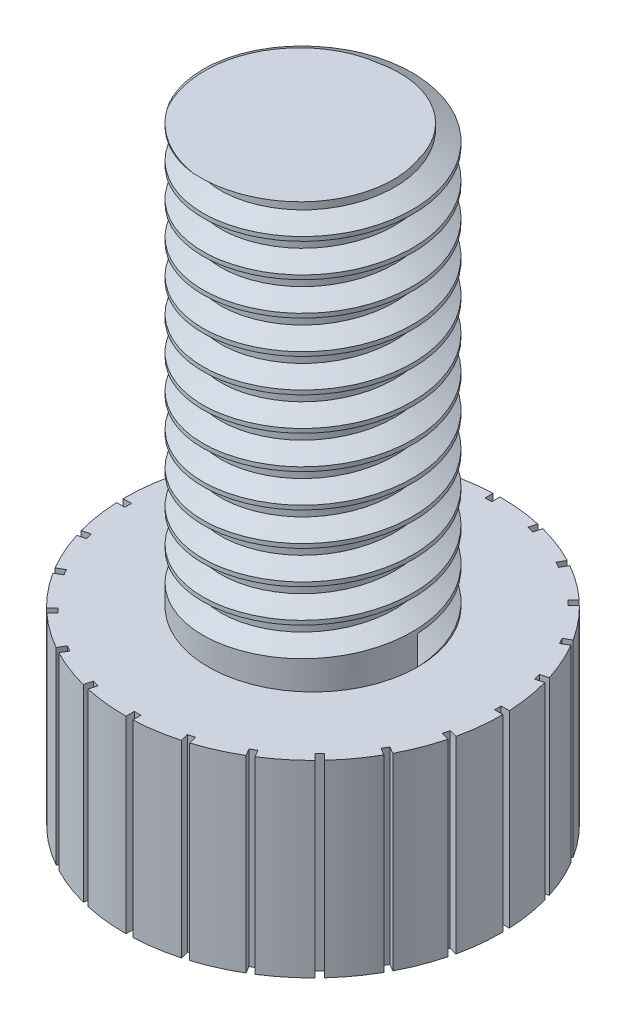
from build123d import *
from build123d.topology import SkipClean

# Parameters (mm, degrees)
SKETCH_1_R               = 1.8
EXTRUDE_1_DEPTH          = 1.8
SKETCH_2_R               = 1
EXTRUDE_2_DEPTH          = 4
THREAD_1_PITCH           = 0.3175
CUT_EXTRUDE_1_DEPTH      = 1
SKETCH_8_W               = 0.063017892
SKETCH_8_H               = 0.222036209
CUT_EXTRUDE_2_DEPTH      = 2
PATTERN_CIRCULAR_2_COUNT = 24


with BuildPart() as part:
    # 草图1 → 凸台-拉伸1 (new body)
    with BuildSketch(Plane(origin=(0, 0, 0), x_dir=(1, 0, 0), z_dir=(0, 1, 0))):
        with Locations(Location((0, 0, 0), (0, 0, 270))):
            Circle(SKETCH_1_R)
    extrude(amount=EXTRUDE_1_DEPTH)

    # Sketch 2 → 凸台-拉伸2 (add)
    with BuildSketch(Plane(origin=(0, 1.8, 0), x_dir=(1, 0, 0), z_dir=(0, 1, 0))):
        with Locations(Location((0, 0, 0), (0, 0, 270))):
            Circle(SKETCH_2_R)
    extrude(amount=EXTRUDE_2_DEPTH)

    # 螺纹线1: the profile of Sketch 2 2 profile screwed along a right-hand helix of 18.897638 turns, 6 arcs to a turn; built about Z, then put on its axis
    with SkipClean():  # the faces are left unmerged after this step: merging them gives an invalid solid
        thread_1_z = Axis((0, 0, 0), (0, 0, 1))
        thread_1_corners = [(1.0003, 0, -0.000173205), (1.0003, 0, 0.277985704), (0.828148085, 0, 0.17859375), (0.828148085, 0, 0.09921875)]
        with BuildLine(mode=Mode.PRIVATE) as thread_1_profile:
            Line(thread_1_corners[0], thread_1_corners[1])
            Line(thread_1_corners[1], thread_1_corners[2])
            Line(thread_1_corners[2], thread_1_corners[3])
            Line(thread_1_corners[3], thread_1_corners[0])
        thread_1_cap = Face(thread_1_profile.wire())
        thread_1_turn_angles = [0, 30, 60, 90, 120, 150, 180, 210, 240, 270, 300, 330, 360]
        thread_1_turn_weights = [1, 0.8660254037844387, 1, 0.8660254037844387, 1, 0.8660254037844387, 1, 0.8660254037844387, 1, 0.8660254037844387, 1, 0.8660254037844387, 1]
        thread_1_turn_rails = [Edge.make_bspline([Vector(p[0], p[1], 0).rotate(thread_1_z, thread_1_turn_angles[k]) / thread_1_turn_weights[k] + Vector(0, 0, p[2] + THREAD_1_PITCH * thread_1_turn_angles[k] / 360) for k in range(13)], [0, 0, 0, 1, 1, 2, 2, 3, 3, 4, 4, 5, 5, 6, 6, 6], 2, thread_1_turn_weights) for p in thread_1_corners]
        thread_1_turn_sides = [Face.make_surface_from_curves(thread_1_turn_rails[p[0]], thread_1_turn_rails[p[1]]) for p in [(0, 1), (1, 2), (2, 3), (3, 0)]]
        thread_1_last_angles = [6480, 6510, 6540, 6570, 6600, 6630, 6660, 6690, 6720, 6750, 6780, 6791.57480315, 6803.149606299]
        thread_1_last_weights = [1, 0.8660254037844387, 1, 0.8660254037844387, 1, 0.8660254037844387, 1, 0.8660254037844387, 1, 0.8660254037844387, 1, 0.9796635825089068, 1]
        thread_1_last_rails = [Edge.make_bspline([Vector(p[0], p[1], 0).rotate(thread_1_z, thread_1_last_angles[k]) / thread_1_last_weights[k] + Vector(0, 0, p[2] + THREAD_1_PITCH * thread_1_last_angles[k] / 360) for k in range(13)], [0, 0, 0, 1, 1, 2, 2, 3, 3, 4, 4, 5, 5, 6, 6, 6], 2, thread_1_last_weights) for p in thread_1_corners]
        thread_1_last_sides = [Face.make_surface_from_curves(thread_1_last_rails[p[0]], thread_1_last_rails[p[1]]) for p in [(0, 1), (1, 2), (2, 3), (3, 0)]]
        thread_1 = Plane(origin=(0, 1.8, 0), x_dir=(1, 0, 0), z_dir=(0, 1, 0)) * Solid(Shell([*[p.moved(Location((0, 0, THREAD_1_PITCH * i))) for i in range(18) for p in thread_1_turn_sides], *thread_1_last_sides, thread_1_cap, thread_1_cap.rotate(thread_1_z, 6803.149606299).moved(Location((0, 0, THREAD_1_PITCH * 6803.149606299 / 360)))]))
        add(thread_1, mode=Mode.SUBTRACT)

    # 草图7 → 切除-拉伸1 (cut)
    with SkipClean():  # the faces are left unmerged after this step: merging them gives an invalid solid
        with BuildSketch(Plane(origin=(0, 0, 0), x_dir=(-1, 0, 0), z_dir=(0, -1, 0))):
            Polygon((-0.866025404, 0), (-0.433012702, -0.75), (0.433012702, -0.75), (0.866025404, 0), (0.433012702, 0.75), (-0.433012702, 0.75), align=None)
        extrude(amount=-CUT_EXTRUDE_1_DEPTH, mode=Mode.SUBTRACT)

    # 草图8 → 切除-拉伸2 (cut)
    with SkipClean():  # the faces are left unmerged after this step: merging them gives an invalid solid
        with BuildSketch(Plane(origin=(0, 0, 0), x_dir=(-1, 0, 0), z_dir=(0, -1, 0))):
            with Locations((0.045326247, 1.83180046)):
                Rectangle(SKETCH_8_W, SKETCH_8_H)
        cut_extrude_2 = extrude(amount=-CUT_EXTRUDE_2_DEPTH, mode=Mode.SUBTRACT)

    # 阵列(圆周)2: 切除-拉伸2 ×24 about axis
    with SkipClean():  # the faces are left unmerged after this step: merging them gives an invalid solid
        pattern_circular_2_axis = Axis((0, 0, 0), (0, 1, 0))
        for i in range(1, PATTERN_CIRCULAR_2_COUNT):
            add(cut_extrude_2.rotate(pattern_circular_2_axis, i * 360 / PATTERN_CIRCULAR_2_COUNT), mode=Mode.SUBTRACT)


solid = part.part
